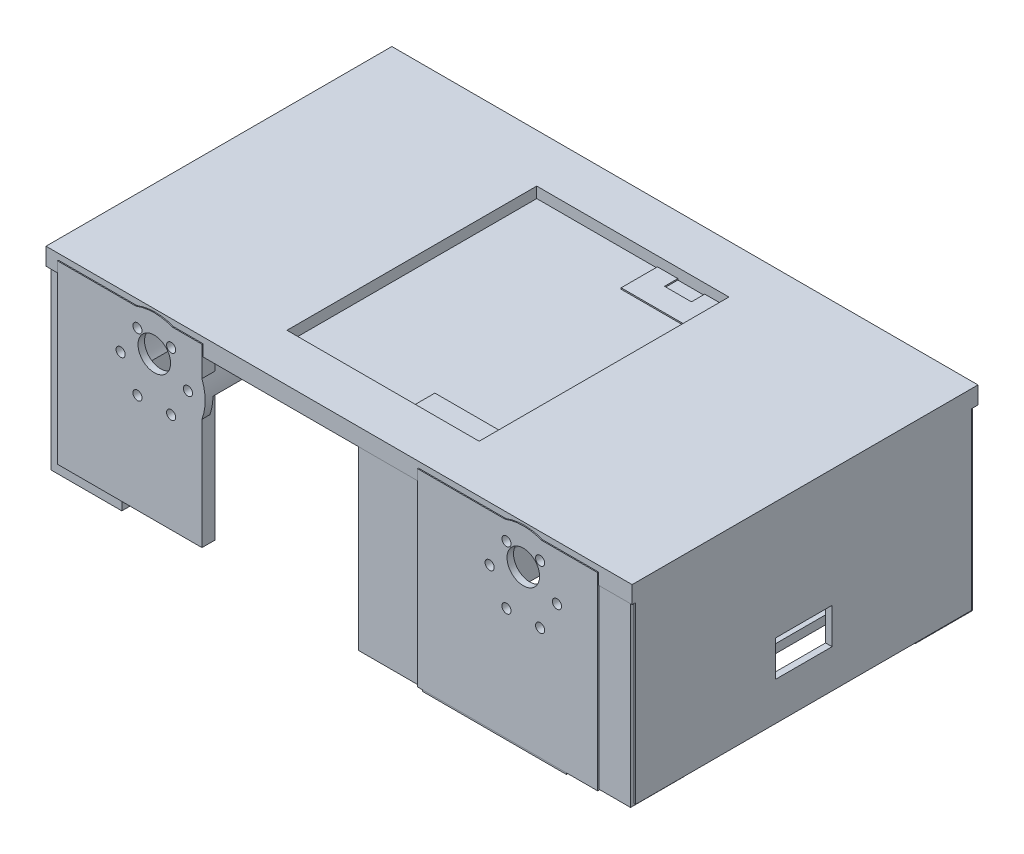
from build123d import *

# Parameters (mm, degrees)
MOTORHOLDERS_DEPTH            = 80
MOTORHOLDERS_DEPTH_BACK       = 80
MOTORHOLDERSSKETCH_R          = 23.41
MOTORHOLDERS_2_DEPTH          = 80
MOTORHOLDERS_2_DEPTH_BACK     = 80
SKETCH4_W                     = 262.774983374
SKETCH4_H                     = 153.112553215
CUT_EXTRUDE1_DEPTH            = 23
POWERBANKHOLDERS_DEPTH        = 30
POWERBANKHOLDERS_DEPTH_BACK   = 55
SKETCH6_W                     = 32.547671801
SKETCH6_H                     = 26.243040839
SKETCH6_W_2                   = 11.777309193
SKETCH6_H_2                   = 11.261449091
POWERBANKHOLDERS_2_DEPTH      = 30
POWERBANKHOLDERS_2_DEPTH_BACK = 55
SKETCH6_W_3                   = 32.64776113
SKETCH6_H_3                   = 26.17260787
SKETCH6_W_4                   = 10.842850571
SKETCH6_H_4                   = 10.347679347
POWERBANKHOLDERS_3_DEPTH      = 30
POWERBANKHOLDERS_3_DEPTH_BACK = 55
SKETCH6_W_5                   = 55.674763771
SKETCH6_H_5                   = 37.111507406
SKETCH6_W_6                   = 12.844328805
SKETCH6_H_6                   = 18.336479725
SKETCH6_W_7                   = 12.407504742
SKETCH6_H_7                   = 16.443461188
POWERBANKHOLDERS_4_DEPTH      = 30
POWERBANKHOLDERS_4_DEPTH_BACK = 55
SKETCH6_W_8                   = 56.474336521
SKETCH6_H_8                   = 35.272094794
SKETCH6_W_9                   = 11.134493861
SKETCH6_H_9                   = 18.035399163
SKETCH6_W_10                  = 16.537391536
SKETCH6_H_10                  = 14.436538778
POWERBANKHOLDERS_5_DEPTH      = 30
POWERBANKHOLDERS_5_DEPTH_BACK = 55
SKETCH6_W_11                  = 28.150495439
SKETCH6_H_11                  = 24.933985152
SKETCH6_W_12                  = 10.177859407
SKETCH6_H_12                  = 9.83070569
POWERBANKHOLDERS_6_DEPTH      = 30
POWERBANKHOLDERS_6_DEPTH_BACK = 55
SKETCH6_W_13                  = 30.670744753
SKETCH6_H_13                  = 26.330219561
SKETCH6_W_14                  = 9.898416255
SKETCH6_H_14                  = 10.635603546
POWERBANKCUT_DEPTH            = 64
BOTTOMPLATE_DEPTH             = 5
BOTTOMPLATE_DEPTH_BACK        = 3
SKETCH21_W                    = 270.025204679
SKETCH21_H                    = 159.338651477
SKETCH21_W_2                  = 88.537320887
SKETCH21_H_2                  = 115.069025425
SKETCH23_W                    = 66.548697278
SKETCH23_H                    = 81.163054316
SKETCH23_W_2                  = 82.936115801
SKETCH23_H_2                  = 87.063331284
MOTORMOUNTINGSUPPORT1_DEPTH   = 6
SKETCH24_W                    = 62.643465408
SKETCH24_H                    = 86.363062387
SKETCH24_W_2                  = 53.914675369
SKETCH24_H_2                  = 86.674739968
MOTORMOUNTINGSUPPOR2_DEPTH    = 6
SKETCH17_R                    = 2.1
SKETCH17_R_2                  = 7.5
MOTORHOLES1_DEPTH             = 31.5
SKETCH19_R                    = 2.1
SKETCH19_R_2                  = 7.5
MOTORHOLES2_DEPTH             = 31.5
BOLTHOLESSKETCH3_R            = 2.1
BOLTHOLESSKETCH3_R_2          = 7.5
MOTORHOLES3_DEPTH             = 31.5
BOLTHOLESSKETCH4_R            = 2.1
BOLTHOLESSKETCH4_R_2          = 7.5
MOTORHOLES4_DEPTH             = 15
SKETCH29_W                    = 154.635205036
SKETCH29_H                    = 84.131588093
SKETCH29_W_2                  = 26
SKETCH29_H_2                  = 16.5
BOSS_EXTRUDE8_DEPTH           = 3
MOTORHOLDERCUT_DEPTH          = 77
MOTORHOLDERCUT_DEPTH_BACK     = 77
MOTORHOLDEREXTRUDESKETCH_R    = 20.415
SKETCH27_W                    = 226.46009322
SKETCH27_H                    = 129.985211715
BOSS_EXTRUDE6_DEPTH           = 3
BOSS_EXTRUDE7_DEPTH           = 1.5
BOSS_EXTRUDE7_DEPTH_BACK      = 2.5
SKETCH28_W                    = 66.387115975
SKETCH28_H                    = 157.698901517


with BuildPart() as part:
    # MotorHoldersSketch → MotorHolders (new, two sides: drawn at the far end of the back side and taken through both)
    with BuildSketch(Plane.XY.offset(-MOTORHOLDERS_DEPTH_BACK)):
        Circle(MOTORHOLDERSSKETCH_R)
    extrude(amount=MOTORHOLDERS_DEPTH + MOTORHOLDERS_DEPTH_BACK)


with BuildPart() as body_2:
    # MotorHoldersSketch → MotorHolders 2 (new, two sides: drawn at the far end of the back side and taken through both)
    with BuildSketch(Plane.XY.offset(-MOTORHOLDERS_2_DEPTH_BACK)):
        with Locations((170, 0)):
            Circle(MOTORHOLDERSSKETCH_R)
    extrude(amount=MOTORHOLDERS_2_DEPTH + MOTORHOLDERS_2_DEPTH_BACK)


with BuildPart() as cut_extrude1_tool:
    # Sketch4 → Cut-Extrude1 (new body)
    with BuildSketch(Plane(origin=(0, 0, 0), x_dir=(1, 0, 0), z_dir=(0, 1, 0))):
        with Locations((89.893628689, 0.176832173)):
            Rectangle(SKETCH4_W, SKETCH4_H)
    extrude(amount=-CUT_EXTRUDE1_DEPTH)


with BuildPart() as part_1:
    add(part.part)

    # Cut-Extrude1: cut by cut_extrude1_tool
    add(cut_extrude1_tool.part, mode=Mode.SUBTRACT)


with BuildPart() as body_2_1:
    add(body_2.part)

    # Cut-Extrude1: cut by cut_extrude1_tool
    add(cut_extrude1_tool.part, mode=Mode.SUBTRACT)


with BuildPart() as body_3:
    # Sketch6 → PowerBankHolders (new, two sides: drawn at the far end of the back side and taken through both)
    with BuildSketch(Plane(origin=(170, -34.829272125, 0), x_dir=(-1, 0, 0), z_dir=(0, -1, 0)).offset(-POWERBANKHOLDERS_DEPTH_BACK)):
        with Locations((203.312010638, 65.827471534)):
            Rectangle(SKETCH6_W, SKETCH6_H)
        with Locations((207.876312411, 66.142860377)):
            Rectangle(SKETCH6_W_2, SKETCH6_H_2, mode=Mode.SUBTRACT)
    extrude(amount=POWERBANKHOLDERS_DEPTH + POWERBANKHOLDERS_DEPTH_BACK)


with BuildPart() as body_4:
    # Sketch6 → PowerBankHolders 2 (new, two sides: drawn at the far end of the back side and taken through both)
    with BuildSketch(Plane(origin=(170, -34.829272125, 0), x_dir=(-1, 0, 0), z_dir=(0, -1, 0)).offset(-POWERBANKHOLDERS_2_DEPTH_BACK)):
        with Locations((202.990846936, -65.195848087)):
            Rectangle(SKETCH6_W_3, SKETCH6_H_3)
        with Locations((206.519672379, -65.314281269)):
            Rectangle(SKETCH6_W_4, SKETCH6_H_4, mode=Mode.SUBTRACT)
    extrude(amount=POWERBANKHOLDERS_2_DEPTH + POWERBANKHOLDERS_2_DEPTH_BACK)


with BuildPart() as body_5:
    # Sketch6 → PowerBankHolders 3 (new, two sides: drawn at the far end of the back side and taken through both)
    with BuildSketch(Plane(origin=(170, -34.829272125, 0), x_dir=(-1, 0, 0), z_dir=(0, -1, 0)).offset(-POWERBANKHOLDERS_3_DEPTH_BACK)):
        with Locations((47.827743092, 59.306920349)):
            Rectangle(SKETCH6_W_5, SKETCH6_H_5)
        with Locations((34.93306737, 60.00949088)):
            Rectangle(SKETCH6_W_6, SKETCH6_H_6, mode=Mode.SUBTRACT)
        with Locations((60.073413265, 59.541495334)):
            Rectangle(SKETCH6_W_7, SKETCH6_H_7, mode=Mode.SUBTRACT)
    extrude(amount=POWERBANKHOLDERS_3_DEPTH + POWERBANKHOLDERS_3_DEPTH_BACK)


with BuildPart() as body_6:
    # Sketch6 → PowerBankHolders 4 (new, two sides: drawn at the far end of the back side and taken through both)
    with BuildSketch(Plane(origin=(170, -34.829272125, 0), x_dir=(-1, 0, 0), z_dir=(0, -1, 0)).offset(-POWERBANKHOLDERS_4_DEPTH_BACK)):
        with Locations((48.322417758, -61.807610384)):
            Rectangle(SKETCH6_W_8, SKETCH6_H_8)
        with Locations((37.73953158, -63.792391966)):
            Rectangle(SKETCH6_W_9, SKETCH6_H_9, mode=Mode.SUBTRACT)
        with Locations((59.979410768, -62.645522509)):
            Rectangle(SKETCH6_W_10, SKETCH6_H_10, mode=Mode.SUBTRACT)
    extrude(amount=POWERBANKHOLDERS_4_DEPTH + POWERBANKHOLDERS_4_DEPTH_BACK)


with BuildPart() as body_7:
    # Sketch6 → PowerBankHolders 5 (new, two sides: drawn at the far end of the back side and taken through both)
    with BuildSketch(Plane(origin=(170, -34.829272125, 0), x_dir=(-1, 0, 0), z_dir=(0, -1, 0)).offset(-POWERBANKHOLDERS_5_DEPTH_BACK)):
        with Locations((-34.775388772, -66.976665205)):
            Rectangle(SKETCH6_W_11, SKETCH6_H_11)
        with Locations((-36.725173705, -67.894738702)):
            Rectangle(SKETCH6_W_12, SKETCH6_H_12, mode=Mode.SUBTRACT)
    extrude(amount=POWERBANKHOLDERS_5_DEPTH + POWERBANKHOLDERS_5_DEPTH_BACK)


with BuildPart() as body_8:
    # Sketch6 → PowerBankHolders 6 (new, two sides: drawn at the far end of the back side and taken through both)
    with BuildSketch(Plane(origin=(170, -34.829272125, 0), x_dir=(-1, 0, 0), z_dir=(0, -1, 0)).offset(-POWERBANKHOLDERS_6_DEPTH_BACK)):
        with Locations((-33.722690809, 64.697564271)):
            Rectangle(SKETCH6_W_13, SKETCH6_H_13)
        with Locations((-36.585452129, 63.859928969)):
            Rectangle(SKETCH6_W_14, SKETCH6_H_14, mode=Mode.SUBTRACT)
    extrude(amount=POWERBANKHOLDERS_6_DEPTH + POWERBANKHOLDERS_6_DEPTH_BACK)


with BuildPart() as powerbankcut_tool:
    # Sketch11 → PowerBankCut (new body)
    with BuildSketch(Plane(origin=(0, -20.425, 0), x_dir=(1, 0, 0), z_dir=(0, 1, 0))):
        Polygon((-18.932660375, -64.758061011), (-18.932660375, 72.241938989), (188.932660375, 63.758061011), (188.932660375, -71.241938989), align=None)
    extrude(amount=-POWERBANKCUT_DEPTH)


with BuildPart() as part_2:
    add(part_1.part)

    # PowerBankCut: cut by powerbankcut_tool
    add(powerbankcut_tool.part, mode=Mode.SUBTRACT)


with BuildPart() as body_2_2:
    add(body_2_1.part)

    # PowerBankCut: cut by powerbankcut_tool
    add(powerbankcut_tool.part, mode=Mode.SUBTRACT)


with BuildPart() as body_3_1:
    add(body_3.part)

    # PowerBankCut: cut by powerbankcut_tool
    add(powerbankcut_tool.part, mode=Mode.SUBTRACT)



with BuildPart() as body_4_1:
    add(body_4.part)

    # PowerBankCut: cut by powerbankcut_tool
    add(powerbankcut_tool.part, mode=Mode.SUBTRACT)


with BuildPart() as body_5_1:
    add(body_5.part)

    # PowerBankCut: cut by powerbankcut_tool
    add(powerbankcut_tool.part, mode=Mode.SUBTRACT)


with BuildPart() as body_6_1:
    add(body_6.part)

    # PowerBankCut: cut by powerbankcut_tool
    add(powerbankcut_tool.part, mode=Mode.SUBTRACT)


with BuildPart() as body_8_1:
    add(body_8.part)

    # PowerBankCut: cut by powerbankcut_tool
    add(powerbankcut_tool.part, mode=Mode.SUBTRACT)


with BuildPart() as body_3_2:
    add(body_3_1.part)

    add(body_4_1.part)  # BottomPlate merges body 4

    add(body_2_2.part)  # BottomPlate merges body 2

    add(part_2.part)  # BottomPlate merges part

    add(body_5_1.part)  # BottomPlate merges body 5

    add(body_6_1.part)  # BottomPlate merges body 6
    # Sketch21 → BottomPlate (add, two sides: drawn at the far end of the back side and taken through both)
    with BuildSketch(Plane(origin=(0, 19.575, 0), x_dir=(1, 0, 0), z_dir=(0, 1, 0)).offset(-BOTTOMPLATE_DEPTH_BACK)):
        with Locations((84.671553553, 0.120575027)):
            Rectangle(SKETCH21_W, SKETCH21_H)
        with Locations((82.978570093, -0.057259585)):
            Rectangle(SKETCH21_W_2, SKETCH21_H_2, mode=Mode.SUBTRACT)
    extrude(amount=BOTTOMPLATE_DEPTH + BOTTOMPLATE_DEPTH_BACK)


    add(body_7.part)  # MotorMountingSupport1 merges body 7
    # Sketch23 → MotorMountingSupport1 (add)
    with BuildSketch(Plane.XY.offset(80)):
        with Locations((-11.315777772, -18.741332274)):
            Rectangle(SKETCH23_W, SKETCH23_H)
        with Locations((162.789906406, -21.691470758)):
            Rectangle(SKETCH23_W_2, SKETCH23_H_2)
    extrude(amount=-MOTORMOUNTINGSUPPORT1_DEPTH)


    add(body_8_1.part)  # MotorMountingSuppor2 merges body 8
    # Sketch24 → MotorMountingSuppor2 (add)
    with BuildSketch(Plane(origin=(0, 0, -80), x_dir=(-1, 0, 0), z_dir=(0, 0, -1))):
        with Locations((-170.868787608, -23.94412431)):
            Rectangle(SKETCH24_W, SKETCH24_H)
        with Locations((2.593149567, -20.814772641)):
            Rectangle(SKETCH24_W_2, SKETCH24_H_2)
    extrude(amount=-MOTORMOUNTINGSUPPOR2_DEPTH)

    # Sketch17 → MotorHoles1 (cut)
    with BuildSketch(Plane.XY.offset(80)):
        with Locations((185.5, 0)):
            Circle(SKETCH17_R)
        with Locations((177.75, -13.42)):
            Circle(SKETCH17_R)
        with Locations((162.25, -13.42)):
            Circle(SKETCH17_R)
        with Locations((154.5, 0)):
            Circle(SKETCH17_R)
        with Locations((162.25, 13.42)):
            Circle(SKETCH17_R)
        with Locations((177.75, 13.42)):
            Circle(SKETCH17_R)
        with Locations((170, 7)):
            Circle(SKETCH17_R_2)
    extrude(amount=-MOTORHOLES1_DEPTH, mode=Mode.SUBTRACT)

    # Sketch19 → MotorHoles2 (cut)
    with BuildSketch(Plane(origin=(0, 0, -80), x_dir=(-1, 0, 0), z_dir=(0, 0, -1))):
        with Locations((-185.5, 0)):
            Circle(SKETCH19_R)
        with Locations((-177.75, -13.42)):
            Circle(SKETCH19_R)
        with Locations((-162.25, -13.42)):
            Circle(SKETCH19_R)
        with Locations((-154.5, 0)):
            Circle(SKETCH19_R)
        with Locations((-162.25, 13.42)):
            Circle(SKETCH19_R)
        with Locations((-177.75, 13.42)):
            Circle(SKETCH19_R)
        with Locations((-170, 7)):
            Circle(SKETCH19_R_2)
    extrude(amount=-MOTORHOLES2_DEPTH, mode=Mode.SUBTRACT)

    # BoltHolesSketch3 → MotorHoles3 (cut)
    with BuildSketch(Plane.XY.offset(80)):
        with Locations((7.75, -13.42)):
            Circle(BOLTHOLESSKETCH3_R)
        with Locations((15.5, 0)):
            Circle(BOLTHOLESSKETCH3_R)
        with Locations((7.75, 13.42)):
            Circle(BOLTHOLESSKETCH3_R)
        with Locations((-7.75, 13.42)):
            Circle(BOLTHOLESSKETCH3_R)
        with Locations((-15.5, 0)):
            Circle(BOLTHOLESSKETCH3_R)
        with Locations((-7.75, -13.42)):
            Circle(BOLTHOLESSKETCH3_R)
        with Locations((0, 7)):
            Circle(BOLTHOLESSKETCH3_R_2)
    extrude(amount=-MOTORHOLES3_DEPTH, mode=Mode.SUBTRACT)

    # BoltHolesSketch4 → MotorHoles4 (cut)
    with BuildSketch(Plane(origin=(0, 0, -80), x_dir=(-1, 0, 0), z_dir=(0, 0, -1))):
        with Locations((-15.5, 0)):
            Circle(BOLTHOLESSKETCH4_R)
        with Locations((-7.75, 13.42)):
            Circle(BOLTHOLESSKETCH4_R)
        with Locations((7.75, 13.42)):
            Circle(BOLTHOLESSKETCH4_R)
        with Locations((15.5, 0)):
            Circle(BOLTHOLESSKETCH4_R)
        with Locations((7.75, -13.42)):
            Circle(BOLTHOLESSKETCH4_R)
        with Locations((-7.75, -13.42)):
            Circle(BOLTHOLESSKETCH4_R)
        with Locations((0, 7)):
            Circle(BOLTHOLESSKETCH4_R_2)
    extrude(amount=-MOTORHOLES4_DEPTH, mode=Mode.SUBTRACT)

    # Sketch29 → Boss-Extrude8 (add)
    with BuildSketch(Plane(origin=(219.684155892, 0, 0), x_dir=(0, 0, -1), z_dir=(1, 0, 0))):
        with Locations((-0.622085312, -21.859578752)):
            Rectangle(SKETCH29_W, SKETCH29_H)
        with Locations((-0.45071267, -38.005879342)):
            Rectangle(SKETCH29_W_2, SKETCH29_H_2, mode=Mode.SUBTRACT)
    extrude(amount=-BOSS_EXTRUDE8_DEPTH)

    # MotorHolderExtrudeSketch → MotorHolderCut (cut, two sides: drawn at the far end of the back side and taken through both)
    with BuildSketch(Plane.XY.offset(-MOTORHOLDERCUT_DEPTH_BACK)):
        with Locations((170, 0)):
            Circle(MOTORHOLDEREXTRUDESKETCH_R)
        Circle(MOTORHOLDEREXTRUDESKETCH_R)
    extrude(amount=MOTORHOLDERCUT_DEPTH + MOTORHOLDERCUT_DEPTH_BACK, mode=Mode.SUBTRACT)

    # Sketch27 → Boss-Extrude6 (add)
    with BuildSketch(Plane(origin=(0, 16.575, 0), x_dir=(-1, 0, 0), z_dir=(0, -1, 0))):
        with Locations((-81.596376522, -0.440920076)):
            Rectangle(SKETCH27_W, SKETCH27_H)
    extrude(amount=-BOSS_EXTRUDE6_DEPTH)

    # Sketch28 → Boss-Extrude7 (add, two sides: drawn at the far end of the back side and taken through both)
    with BuildSketch(Plane(origin=(0, -64.829272125, 0), x_dir=(-1, 0, 0), z_dir=(0, -1, 0)).offset(-BOSS_EXTRUDE7_DEPTH_BACK)):
        with Locations((-156.196154729, -0.699595313)):
            Rectangle(SKETCH28_W, SKETCH28_H)
    extrude(amount=BOSS_EXTRUDE7_DEPTH + BOSS_EXTRUDE7_DEPTH_BACK)


solid = body_3_2.part
